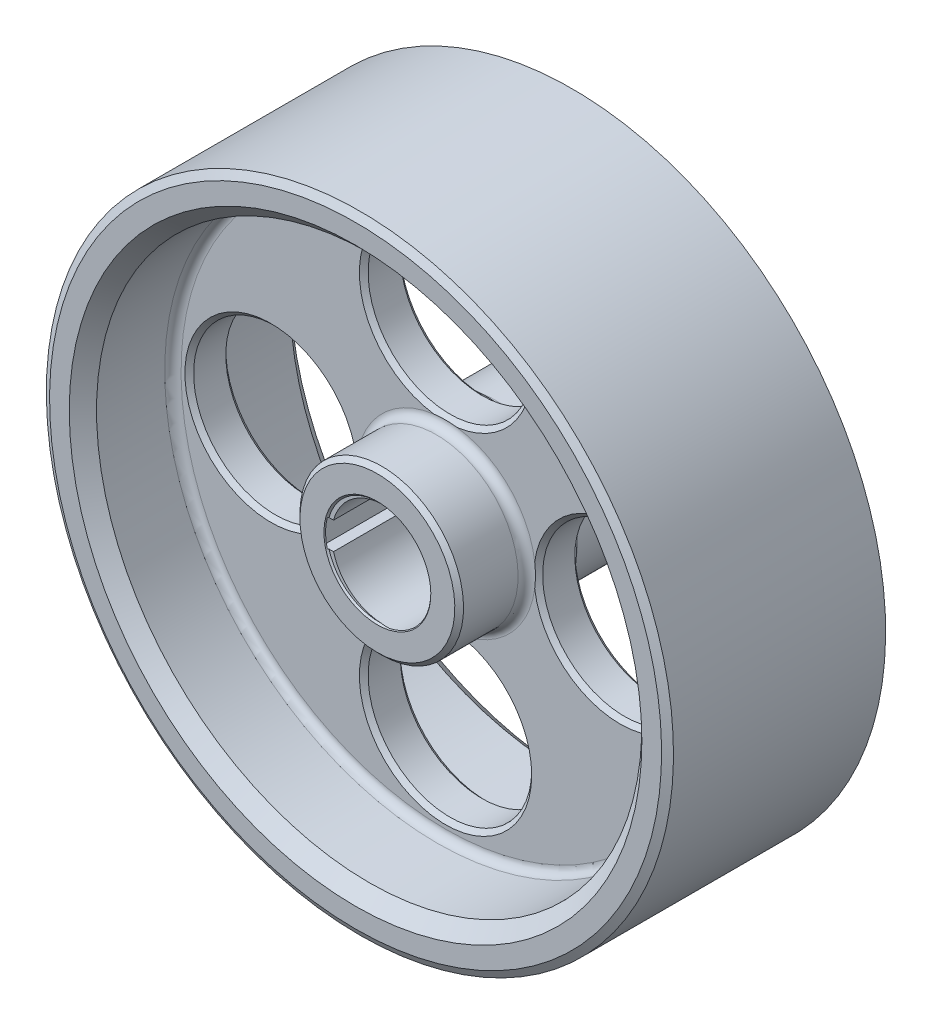
from build123d import *

# Parameters (mm, degrees)
SKETCH3_R                      = 115
BOSS_EXTRUDE1_DEPTH            = 81
CUT_EXTRUDE1_REACH             = 169.601
SKETCH9_R                      = 30
CUT_EXTRUDE1_DIRECTION_2_REACH = 169.601
CUT_EXTRUDE2_DEPTH             = 32.2


# Read off the part's stored shape, not the designer's step: Cut-Revolve11
with BuildPart() as part:
    # Sketch3 → Boss-Extrude1 (new body)
    with BuildSketch(Plane.XY):
        Circle(SKETCH3_R)
    extrude(amount=BOSS_EXTRUDE1_DEPTH)

    # Sketch5 → Cut-Revolve3 (revolve, cut)
    with BuildSketch(Plane(origin=(0, 0, 0), x_dir=(0, 0, -1), z_dir=(1, 0, 0)), mode=Mode.PRIVATE) as cut_revolve3_sk:
        Polygon((-81, 105), (-76, 100), (-76, 0), (-81, 0), align=None)
        Polygon((-5, 0), (0, 0), (0, 105), (-5, 100), align=None)
        Polygon((0, 112.228718708), (-1.6, 115), (-79.4, 115), (-81, 112.228718708), (-81, 120.654607227), (0, 120.654607227), align=None)
    revolve(cut_revolve3_sk.sketch.rotate(Axis((0, 0, 76), (0, 0, -1)), 180), axis=Axis((0, 0, 76), (0, 0, -1)), mode=Mode.SUBTRACT)

    # Cut-Revolve11 outline → Cut-Revolve11 (revolve, cut)
    with BuildSketch(Plane.XZ):
        Polygon((0, 72.4), (19, 72.4), (19.6, 73), (0, 73), align=None)
        Polygon((19, 8.6), (0, 8.6), (0, 8), (19.6, 8), align=None)
    revolve(axis=Axis((0, 0, 0), (0, 0, 1)), mode=Mode.SUBTRACT)

    # Sketch6 → Cut-Revolve4 (revolve, cut)
    with BuildSketch(Plane(origin=(0, 0, 0), x_dir=(0, 0, -1), z_dir=(1, 0, 0)), mode=Mode.PRIVATE) as cut_revolve4_sk:
        with BuildLine():
            Line((-76, 100), (-51, 100))
            ThreePointArc((-51, 100), (-48.878679656, 99.121320344), (-48, 97))
            Line((-48, 97), (-48, 32.973213749))
            ThreePointArc((-48, 32.973213749), (-49.025158234, 30.714895791), (-51.4, 30))
            Line((-51.4, 30), (-71.4, 30))
            Line((-71.4, 30), (-73, 28.4))
            Line((-73, 28.4), (-73, 0))
            Line((-73, 0), (-76, 0))
            Line((-76, 0), (-76, 100))
        make_face()
        with BuildLine():
            Line((-8, 0), (-5, 0))
            Line((-5, 0), (-5, 100))
            Line((-5, 100), (-30, 100))
            ThreePointArc((-30, 100), (-32.121320344, 99.121320344), (-33, 97))
            Line((-33, 97), (-33, 32.973213749))
            ThreePointArc((-33, 32.973213749), (-31.974841766, 30.714895791), (-29.6, 30))
            Line((-29.6, 30), (-9.6, 30))
            Line((-9.6, 30), (-8, 28.4))
            Line((-8, 28.4), (-8, 0))
        make_face()
    revolve(cut_revolve4_sk.sketch.rotate(Axis((0, 0, 76), (0, 0, -1)), 180), axis=Axis((0, 0, 76), (0, 0, -1)), mode=Mode.SUBTRACT)

    # Cut-Extrude1: up to this face of the body (flat: up to its plane)
    cut_extrude1_end = Plane(part.part.faces().sort_by_distance((0, 94.256425689, 48))[0])
    # Sketch9 → Cut-Extrude1 (cut, up to the picked face)
    with BuildSketch(Plane.XY.offset(40.5), mode=Mode.PRIVATE) as cut_extrude1_sk1:
        with Locations(Location((0, 64, 0), (0, 0, 90))):
            Circle(SKETCH9_R)
    cut_extrude1_tool1 = split(extrude(cut_extrude1_sk1.sketch, amount=CUT_EXTRUDE1_REACH, mode=Mode.PRIVATE), bisect_by=cut_extrude1_end, keep=Keep.BOTH, mode=Mode.PRIVATE)
    # Sketch9 → Cut-Extrude1 (cut, up to the picked face)
    with BuildSketch(Plane.XY.offset(40.5), mode=Mode.PRIVATE) as cut_extrude1_sk2:
        with Locations(Location((-64, 0, 0), (0, 0, 90))):
            Circle(SKETCH9_R)
    cut_extrude1_tool2 = split(extrude(cut_extrude1_sk2.sketch, amount=CUT_EXTRUDE1_REACH, mode=Mode.PRIVATE), bisect_by=cut_extrude1_end, keep=Keep.BOTH, mode=Mode.PRIVATE)
    # Sketch9 → Cut-Extrude1 (cut, up to the picked face)
    with BuildSketch(Plane.XY.offset(40.5), mode=Mode.PRIVATE) as cut_extrude1_sk3:
        with Locations(Location((0, -64, 0), (0, 0, 90))):
            Circle(SKETCH9_R)
    cut_extrude1_tool3 = split(extrude(cut_extrude1_sk3.sketch, amount=CUT_EXTRUDE1_REACH, mode=Mode.PRIVATE), bisect_by=cut_extrude1_end, keep=Keep.BOTH, mode=Mode.PRIVATE)
    # Sketch9 → Cut-Extrude1 (cut, up to the picked face)
    with BuildSketch(Plane.XY.offset(40.5), mode=Mode.PRIVATE) as cut_extrude1_sk4:
        with Locations(Location((64, 0, 0), (0, 0, 90))):
            Circle(SKETCH9_R)
    cut_extrude1_tool4 = split(extrude(cut_extrude1_sk4.sketch, amount=CUT_EXTRUDE1_REACH, mode=Mode.PRIVATE), bisect_by=cut_extrude1_end, keep=Keep.BOTH, mode=Mode.PRIVATE)
    add(cut_extrude1_tool1.solids().sort_by(Axis((0, 64, 40.5), (0, 0, 1)))[0], mode=Mode.SUBTRACT)
    add(cut_extrude1_tool2.solids().sort_by(Axis((-64, 0, 40.5), (0, 0, 1)))[0], mode=Mode.SUBTRACT)
    add(cut_extrude1_tool3.solids().sort_by(Axis((0, -64, 40.5), (0, 0, 1)))[0], mode=Mode.SUBTRACT)
    add(cut_extrude1_tool4.solids().sort_by(Axis((64, 0, 40.5), (0, 0, 1)))[0], mode=Mode.SUBTRACT)

    # Cut-Extrude1 direction 2: up to this face of the body (flat: up to its plane)
    cut_extrude1_direction_2_end = Plane(part.part.faces().sort_by_distance((0, 94.256425689, 33))[0])
    # Sketch9 → Cut-Extrude1 direction 2 (cut, up to the picked face)
    with BuildSketch(Plane.XY.offset(40.5), mode=Mode.PRIVATE) as cut_extrude1_direction_2_sk1:
        with Locations(Location((0, 64, 0), (0, 0, 90))):
            Circle(SKETCH9_R)
    cut_extrude1_direction_2_tool1 = split(extrude(cut_extrude1_direction_2_sk1.sketch, amount=-CUT_EXTRUDE1_DIRECTION_2_REACH, mode=Mode.PRIVATE), bisect_by=cut_extrude1_direction_2_end, keep=Keep.BOTH, mode=Mode.PRIVATE)
    # Sketch9 → Cut-Extrude1 direction 2 (cut, up to the picked face)
    with BuildSketch(Plane.XY.offset(40.5), mode=Mode.PRIVATE) as cut_extrude1_direction_2_sk2:
        with Locations(Location((-64, 0, 0), (0, 0, 90))):
            Circle(SKETCH9_R)
    cut_extrude1_direction_2_tool2 = split(extrude(cut_extrude1_direction_2_sk2.sketch, amount=-CUT_EXTRUDE1_DIRECTION_2_REACH, mode=Mode.PRIVATE), bisect_by=cut_extrude1_direction_2_end, keep=Keep.BOTH, mode=Mode.PRIVATE)
    # Sketch9 → Cut-Extrude1 direction 2 (cut, up to the picked face)
    with BuildSketch(Plane.XY.offset(40.5), mode=Mode.PRIVATE) as cut_extrude1_direction_2_sk3:
        with Locations(Location((0, -64, 0), (0, 0, 90))):
            Circle(SKETCH9_R)
    cut_extrude1_direction_2_tool3 = split(extrude(cut_extrude1_direction_2_sk3.sketch, amount=-CUT_EXTRUDE1_DIRECTION_2_REACH, mode=Mode.PRIVATE), bisect_by=cut_extrude1_direction_2_end, keep=Keep.BOTH, mode=Mode.PRIVATE)
    # Sketch9 → Cut-Extrude1 direction 2 (cut, up to the picked face)
    with BuildSketch(Plane.XY.offset(40.5), mode=Mode.PRIVATE) as cut_extrude1_direction_2_sk4:
        with Locations(Location((64, 0, 0), (0, 0, 90))):
            Circle(SKETCH9_R)
    cut_extrude1_direction_2_tool4 = split(extrude(cut_extrude1_direction_2_sk4.sketch, amount=-CUT_EXTRUDE1_DIRECTION_2_REACH, mode=Mode.PRIVATE), bisect_by=cut_extrude1_direction_2_end, keep=Keep.BOTH, mode=Mode.PRIVATE)
    add(cut_extrude1_direction_2_tool1.solids().sort_by(Axis((0, 64, 40.5), (0, 0, -1)))[0], mode=Mode.SUBTRACT)
    add(cut_extrude1_direction_2_tool2.solids().sort_by(Axis((-64, 0, 40.5), (0, 0, -1)))[0], mode=Mode.SUBTRACT)
    add(cut_extrude1_direction_2_tool3.solids().sort_by(Axis((0, -64, 40.5), (0, 0, -1)))[0], mode=Mode.SUBTRACT)
    add(cut_extrude1_direction_2_tool4.solids().sort_by(Axis((64, 0, 40.5), (0, 0, -1)))[0], mode=Mode.SUBTRACT)

    # Sketch10 → Cut-Extrude2 (cut, symmetric)
    with BuildSketch(Plane.XY.offset(40.5)):
        with BuildLine():
            Line((-20.65, 5), (-20.65, -5))
            Line((-20.65, -5), (-16.68030278, -5))
            ThreePointArc((-16.68030278, -5), (20.65, 0), (-16.68030278, 5))
            Line((-16.68030278, 5), (-20.65, 5))
        make_face()
    extrude(amount=CUT_EXTRUDE2_DEPTH, both=True, mode=Mode.SUBTRACT)

    # Sketch15 → Cut-Revolve7 (revolve, cut)
    with BuildSketch(Plane(origin=(0, 0, 0), x_dir=(0, 0, -1), z_dir=(1, 0, 0)), mode=Mode.PRIVATE) as cut_revolve7_sk:
        Polygon((-48, 95.6), (-48, 64), (-46.4, 64), (-46.4, 94), align=None)
        Polygon((-33, 64), (-34.6, 64), (-34.6, 94), (-33, 95.6), align=None)
    revolve(cut_revolve7_sk.sketch.rotate(Axis((0, 64, 40.5), (0, 0, -1)), 90), axis=Axis((0, 64, 40.5), (0, 0, -1)), mode=Mode.SUBTRACT)

    # Sketch17 → Cut-Revolve8 (revolve, cut)
    with BuildSketch(Plane(origin=(0, 0, 0), x_dir=(0, 0, -1), z_dir=(1, 0, 0)), mode=Mode.PRIVATE) as cut_revolve8_sk:
        Polygon((-48, -32.4), (-48, -64), (-46.4, -64), (-46.4, -34), align=None)
        Polygon((-33, -64), (-34.6, -64), (-34.6, -34), (-33, -32.4), align=None)
    revolve(cut_revolve8_sk.sketch.rotate(Axis((0, -64, 40.5), (0, 0, -1)), 90), axis=Axis((0, -64, 40.5), (0, 0, -1)), mode=Mode.SUBTRACT)

    # Sketch18 → Cut-Revolve9 (revolve, cut)
    with BuildSketch(Plane(origin=(64, 0, 0), x_dir=(0, 0, -1), z_dir=(1, 0, 0)), mode=Mode.PRIVATE) as cut_revolve9_sk:
        Polygon((-48, 31.6), (-48, 0), (-46.4, 0), (-46.4, 30), align=None)
        Polygon((-33, 0), (-34.6, 0), (-34.6, 30), (-33, 31.6), align=None)
    revolve(cut_revolve9_sk.sketch.rotate(Axis((64, 0, 40.5), (0, 0, -1)), 90), axis=Axis((64, 0, 40.5), (0, 0, -1)), mode=Mode.SUBTRACT)

    # Sketch19 → Cut-Revolve10 (revolve, cut)
    with BuildSketch(Plane(origin=(-64, 0, 0), x_dir=(0, 0, -1), z_dir=(1, 0, 0)), mode=Mode.PRIVATE) as cut_revolve10_sk:
        Polygon((-48, 31.6), (-48, 0), (-46.4, 0), (-46.4, 30), align=None)
        Polygon((-33, 0), (-34.6, 0), (-34.6, 30), (-33, 31.6), align=None)
    revolve(cut_revolve10_sk.sketch.rotate(Axis((-64, 0, 40.5), (0, 0, -1)), 90), axis=Axis((-64, 0, 40.5), (0, 0, -1)), mode=Mode.SUBTRACT)


solid = part.part
